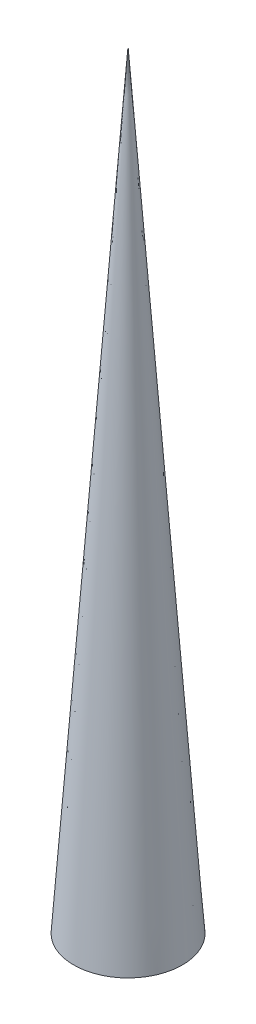
from build123d import *

# Parameters (mm, degrees)
SHELL1_T = -3.81


with BuildPart() as part:
    # Sketch2 → Revolve1 (revolve)
    with BuildSketch(Plane.XY):
        Polygon((0, 0), (-10.795, 0), (0, 152.4), align=None)
    revolve(axis=Axis((0, 0, 0), (0, 1, 0)))

    # Shell1
    shell1_openings = [part.faces().sort_by_distance(p)[0] for p in [
        (0, 0, 0),
    ]]
    offset(amount=SHELL1_T, openings=shell1_openings, kind=Kind.INTERSECTION)


solid = part.part
